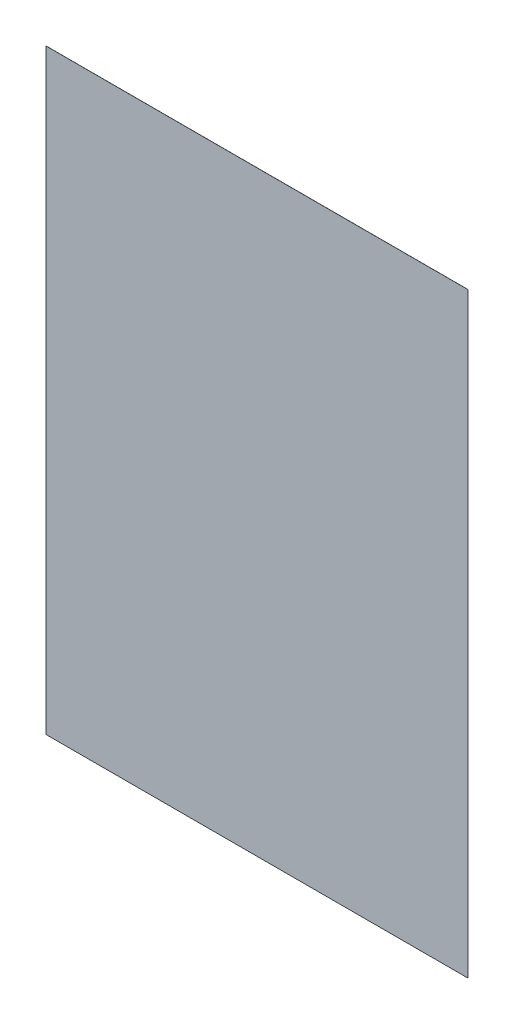
from build123d import *

# Parameters (mm, degrees)
SKETCH1_W           = 210
SKETCH1_H           = 297
BOSS_EXTRUDE1_DEPTH = 0.05


with BuildPart() as part:
    # Sketch1 → Boss-Extrude1 (new body)
    with BuildSketch(Plane.XY):
        Rectangle(SKETCH1_W, SKETCH1_H)
    extrude(amount=BOSS_EXTRUDE1_DEPTH)


solid = part.part
